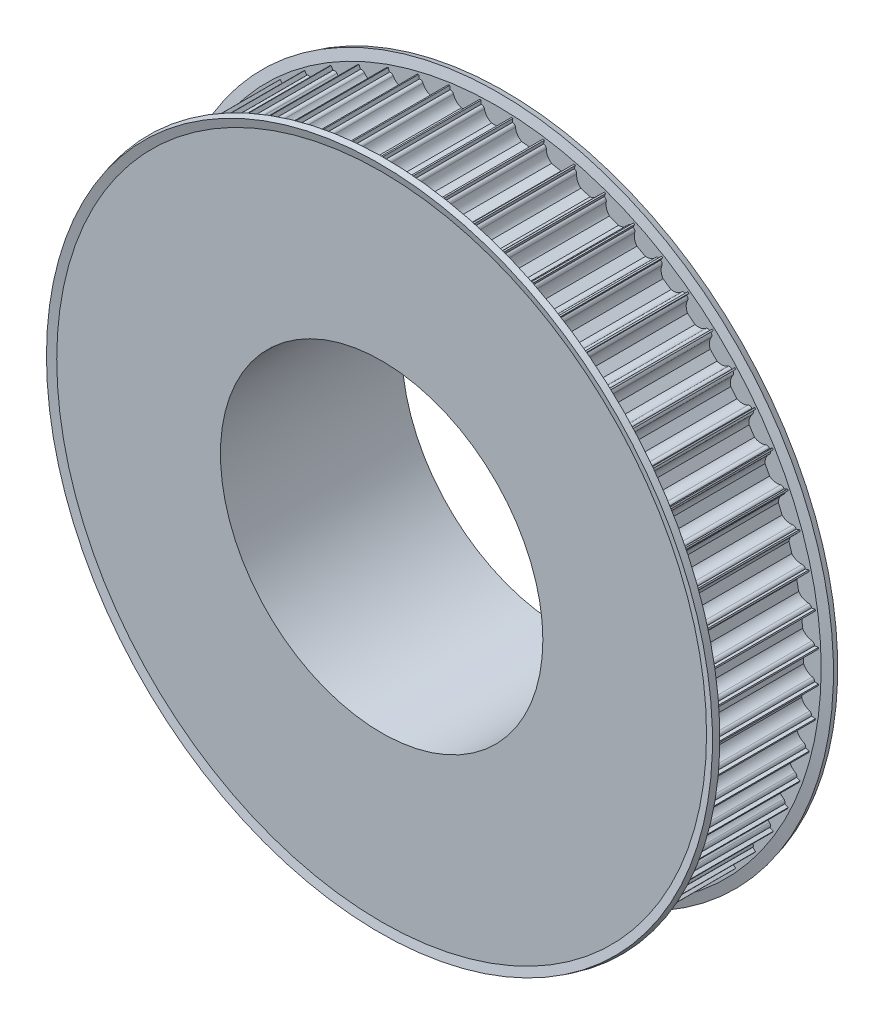
from build123d import *

# Parameters (mm, degrees)
CUT_EXTRUDE1_REACH = 123.758
CIRPATTERN1_COUNT  = 64


with BuildPart() as part:
    # Sketch1 → Revolve1 (revolve)
    with BuildSketch(Plane(origin=(0, 0, 0), x_dir=(0, 0, -1), z_dir=(1, 0, 0))):
        Polygon((0, 40), (45, 40), (45, 55.5), (30, 55.5), (30, 80), (0, 80), align=None)
    revolve(axis=Axis((0, 0, 0), (0, 0, -1)))

    # Sketch2 → Cut-Extrude1 (cut, up to next)
    with BuildSketch(Plane.XY, mode=Mode.PRIVATE) as cut_extrude1_sk1:
        with BuildLine():
            Line((-3.674234614, 79), (-3.75, 79))
            Line((-3.75, 79), (-3.75, 81))
            Line((-3.75, 81), (3.75, 81))
            Line((3.75, 81), (3.75, 79))
            Line((3.75, 79), (3.674234614, 79))
            ThreePointArc((3.674234614, 79), (3.199892965, 78.830947502), (2.939387691, 78.4))
            ThreePointArc((2.939387691, 78.4), (2.331759211, 77.112435701), (1.198957881, 76.25))
            Line((1.198957881, 76.25), (-1.198957881, 76.25))
            ThreePointArc((-1.198957881, 76.25), (-2.331759211, 77.112435701), (-2.939387691, 78.4))
            ThreePointArc((-2.939387691, 78.4), (-3.199892965, 78.830947502), (-3.674234614, 79))
        make_face()
    cut_extrude1_tool1 = extrude(cut_extrude1_sk1.sketch, amount=-CUT_EXTRUDE1_REACH, mode=Mode.PRIVATE) & part.part
    cut_extrude1 = cut_extrude1_tool1.solids().sort_by_distance((0, 78.935169, 0))[0]
    add(cut_extrude1, mode=Mode.SUBTRACT)

    # CirPattern1: Cut-Extrude1 ×64 about axis
    cirpattern1_axis = Axis((0, 0, 0), (0, 0, 1))
    for i in range(1, CIRPATTERN1_COUNT):
        add(cut_extrude1.rotate(cirpattern1_axis, i * 360 / CIRPATTERN1_COUNT), mode=Mode.SUBTRACT)

    # Sketch3 → Revolve4 (revolve)
    with BuildSketch(Plane(origin=(0, 0, 0), x_dir=(0, 0, -1), z_dir=(1, 0, 0))):
        Polygon((30, 55.5), (30, 80.61), (30.539052531, 82.621771432), (29.090163791, 83.01), (28.447085729, 80.61), (28.447085729, 55.5), align=None)
        Polygon((1.552914271, 80.61), (1.552914271, 55.5), (0, 55.5), (0, 80.61), (-0.539052531, 82.621771432), (0.909836209, 83.01), align=None)
    revolve(axis=Axis((0, 0, 0), (0, 0, 1)))


solid = part.part
